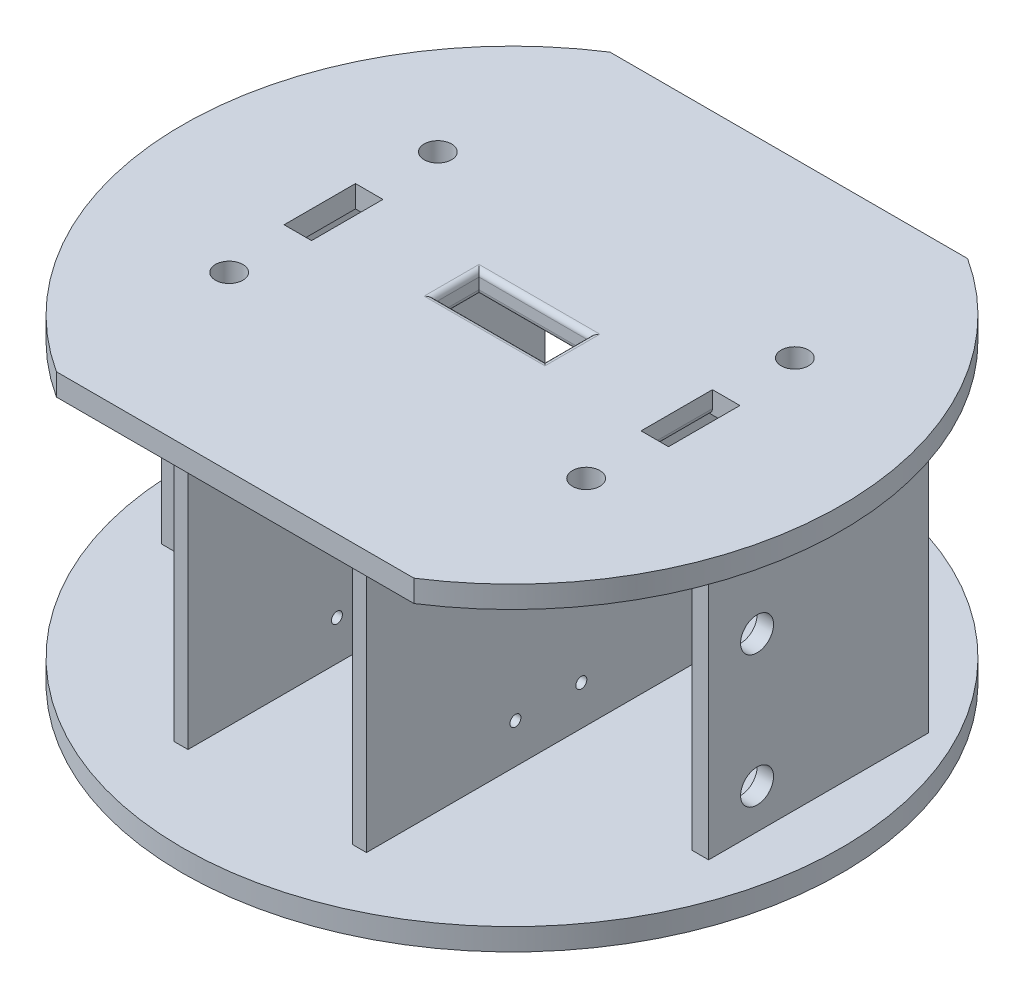
from build123d import *

# Parameters (mm, degrees)
SKETCH1_R                         = 60
BASE_BASE_DEPTH                   = 4
SIDE_START                        = -4
SIDE_CUTS_DEPTH                   = 4
SKETCH3_W                         = 5
SKETCH3_H                         = 13
TENDON_PASS_THROUGH_OPENING_DEPTH = 4
SKETCH4_R                         = 2.5
BASE_MOUNTING_HOLES_DEPTH         = 79.461200603
SKETCH5_W                         = 3
SKETCH5_H                         = 40
SKETCH5_W_2                       = 2.5
SKETCH5_H_2                       = 65
BOSS_EXTRUDE1_DEPTH               = 50
LPATTERN1_COUNT                   = 2
LPATTERN1_PITCH                   = 54
CUT_EXTRUDE1_REACH                = 138.279
SKETCH7_R                         = 3
CUT_EXTRUDE2_START                = -35
SKETCH9_R                         = 1
CUT_EXTRUDE2_DEPTH                = 35
LPATTERN2_COUNT                   = 2
LPATTERN2_PITCH                   = 96.6
FILLET1_R                         = 1
FILLET2_R                         = 1
SKETCH11_W                        = 12
SKETCH11_H                        = 6
CUT_EXTRUDE3_DEPTH                = 41
FILLET3_R                         = 1
FILLET4_R                         = 1
CUT_EXTRUDE4_REACH                = 104.781
SKETCH12_W                        = 20
SKETCH12_H                        = 8
FILLET5_R                         = 1


with BuildPart() as part:
    # Sketch1 → Base Base (new body)
    with BuildSketch(Plane(origin=(0, 0, 0), x_dir=(1, 0, 0), z_dir=(0, 1, 0))):
        with Locations(Location((0, 0, 0), (0, 0, 270))):
            Circle(SKETCH1_R)
    base_base = extrude(amount=BASE_BASE_DEPTH)

    # Sketch2 → Side Cuts (cut)
    with BuildSketch(Plane(origin=(0, 4, 0), x_dir=(1, 0, 0), z_dir=(0, 1, 0)).offset(SIDE_START)):
        with BuildLine():
            Line((-32.555183919, 50.4), (32.555183919, 50.4))
            ThreePointArc((32.555183919, 50.4), (0, 60), (-32.555183919, 50.4))
        make_face()
        with BuildLine():
            Line((-32.555183919, -50.4), (32.555183919, -50.4))
            ThreePointArc((32.555183919, -50.4), (0, -60), (-32.555183919, -50.4))
        make_face()
    extrude(amount=SIDE_CUTS_DEPTH, mode=Mode.SUBTRACT)

    # Sketch3 → Tendon Pass Through Opening (cut)
    with BuildSketch(Plane(origin=(0, 4, 0), x_dir=(1, 0, 0), z_dir=(0, 1, 0))):
        with Locations((32.5, 0)):
            Rectangle(SKETCH3_W, SKETCH3_H)
        with Locations((-32.5, 0)):
            Rectangle(SKETCH3_W, SKETCH3_H)
    extrude(amount=-TENDON_PASS_THROUGH_OPENING_DEPTH, mode=Mode.SUBTRACT)

    # Sketch4 → Base Mounting Holes (cut, through all)
    with BuildSketch(Plane(origin=(0, 4, 0), x_dir=(1, 0, 0), z_dir=(0, 1, 0))):
        with Locations(Location((32.5, 19, 0), (0, 0, 270))):
            Circle(SKETCH4_R)
        with Locations(Location((32.5, -19, 0), (0, 0, 90))):
            Circle(SKETCH4_R)
        with Locations(Location((-32.5, -19, 0), (0, 0, 270))):
            Circle(SKETCH4_R)
        with Locations(Location((-32.5, 19, 0), (0, 0, 90))):
            Circle(SKETCH4_R)
    extrude(amount=-BASE_MOUNTING_HOLES_DEPTH, mode=Mode.SUBTRACT)

    # Sketch5 → Boss-Extrude1 (add)
    with BuildSketch(Plane.XZ):
        with Locations((-48.3, -6)):
            Rectangle(SKETCH5_W, SKETCH5_H)
        with Locations((16.25, 11.5)):
            Rectangle(SKETCH5_W_2, SKETCH5_H_2)
        with Locations((48.3, -6)):
            Rectangle(SKETCH5_W, SKETCH5_H)
        with Locations((-16.25, 11.5)):
            Rectangle(SKETCH5_W_2, SKETCH5_H_2)
    extrude(amount=BOSS_EXTRUDE1_DEPTH)

    # LPattern1: Base Base ×2
    with Locations(*[(0, -i * LPATTERN1_PITCH, 0) for i in range(1, LPATTERN1_COUNT)]):
        add(base_base)

    # Sketch7 → Cut-Extrude1 (cut, up to next)
    with BuildSketch(Plane.ZY.offset(49.8), mode=Mode.PRIVATE) as cut_extrude1_sk1:
        with Locations((5.177676652, -18.760132428)):
            Circle(SKETCH7_R)
    cut_extrude1_tool1 = extrude(cut_extrude1_sk1.sketch, amount=-CUT_EXTRUDE1_REACH, mode=Mode.PRIVATE) & part.part
    # Sketch7 → Cut-Extrude1 (cut, up to next)
    with BuildSketch(Plane.ZY.offset(49.8), mode=Mode.PRIVATE) as cut_extrude1_sk2:
        with Locations((5.177676652, -42.760132428)):
            Circle(SKETCH7_R)
    cut_extrude1_tool2 = extrude(cut_extrude1_sk2.sketch, amount=-CUT_EXTRUDE1_REACH, mode=Mode.PRIVATE) & part.part
    cut_extrude1_1 = cut_extrude1_tool1.solids().sort_by_distance((-49.8, -18.760132, 5.177677))[0]
    add(cut_extrude1_1, mode=Mode.SUBTRACT)
    cut_extrude1_2 = cut_extrude1_tool2.solids().sort_by_distance((-49.8, -42.760132, 5.177677))[0]
    add(cut_extrude1_2, mode=Mode.SUBTRACT)
    cut_extrude1 = cut_extrude1_1 + cut_extrude1_2  # Cut-Extrude1 as one shape, for the pattern or mirror that repeats it

    # Sketch9 → Cut-Extrude2 (cut)
    with BuildSketch(Plane.ZY.offset(17.5).offset(CUT_EXTRUDE2_START)):
        with Locations((4.875, -18.760132428)):
            Circle(SKETCH9_R)
        with Locations((4.875, -42.760132428)):
            Circle(SKETCH9_R)
        with Locations((16.875, -18.760132428)):
            Circle(SKETCH9_R)
        with Locations((16.875, -42.760132428)):
            Circle(SKETCH9_R)
    extrude(amount=CUT_EXTRUDE2_DEPTH, mode=Mode.SUBTRACT)

    # LPattern2: Cut-Extrude1 ×2
    with Locations(*[(i * LPATTERN2_PITCH, 0, 0) for i in range(1, LPATTERN2_COUNT)]):
        add(cut_extrude1, mode=Mode.SUBTRACT)

    # Fillet1
    fillet1_edges = [part.edges().sort_by_distance(p)[0] for p in [
        (-30, 0, 0),
    ]]
    fillet(fillet1_edges, radius=FILLET1_R)

    # Fillet2
    fillet2_edges = [part.edges().sort_by_distance(p)[0] for p in [
        (30, 0, 0),
    ]]
    fillet(fillet2_edges, radius=FILLET2_R)

    # Sketch11 → Cut-Extrude3 (cut)
    with BuildSketch(Plane(origin=(17.5, 0, 0), x_dir=(0, 0, -1), z_dir=(1, 0, 0))):
        with Locations((-10.875, -5.611758363)):
            Rectangle(SKETCH11_W, SKETCH11_H)
    extrude(amount=-CUT_EXTRUDE3_DEPTH, mode=Mode.SUBTRACT)

    # Fillet3
    fillet3_edges = [part.edges().sort_by_distance(p)[0] for p in [
        (-17.5, -8.611758363, 10.875),
        (15, -8.611758363, 10.875),
        (-15, -8.611758363, 10.875),
        (17.5, -8.611758363, 10.875),
    ]]
    fillet(fillet3_edges, radius=FILLET3_R)

    # Fillet4
    fillet4_edges = [part.edges().sort_by_distance(p)[0] for p in [
        (-17.5, -6.111758363, 16.875),
        (15, -6.111758363, 16.875),
        (-15, -6.111758363, 16.875),
        (17.5, -6.111758363, 16.875),
        (-15, -6.111758363, 4.875),
        (-17.5, -6.111758363, 4.875),
        (17.5, -6.111758363, 4.875),
        (15, -6.111758363, 4.875),
    ]]
    fillet(fillet4_edges, radius=FILLET4_R - 0.0001)  # a hair under: the kernel refuses the full size

    # Sketch12 → Cut-Extrude4 (cut, up to next)
    with BuildSketch(Plane(origin=(0, 4, 0), x_dir=(1, 0, 0), z_dir=(0, 1, 0)), mode=Mode.PRIVATE) as cut_extrude4_sk1:
        Rectangle(SKETCH12_W, SKETCH12_H)
    cut_extrude4_tool1 = extrude(cut_extrude4_sk1.sketch, amount=-CUT_EXTRUDE4_REACH, mode=Mode.PRIVATE) & part.part
    add(cut_extrude4_tool1.solids().sort_by_distance((0, 4, 0))[0], mode=Mode.SUBTRACT)

    # Fillet5
    fillet5_edges = [part.edges().sort_by_distance(p)[0] for p in [
        (-10, 4, 0),
        (0, 4, 4),
        (10, 4, 0),
        (0, 4, -4),
        (0, 0, 4),
        (-10, 0, 0),
        (0, 0, -4),
        (10, 0, 0),
    ]]
    fillet(fillet5_edges, radius=FILLET5_R)


solid = part.part
